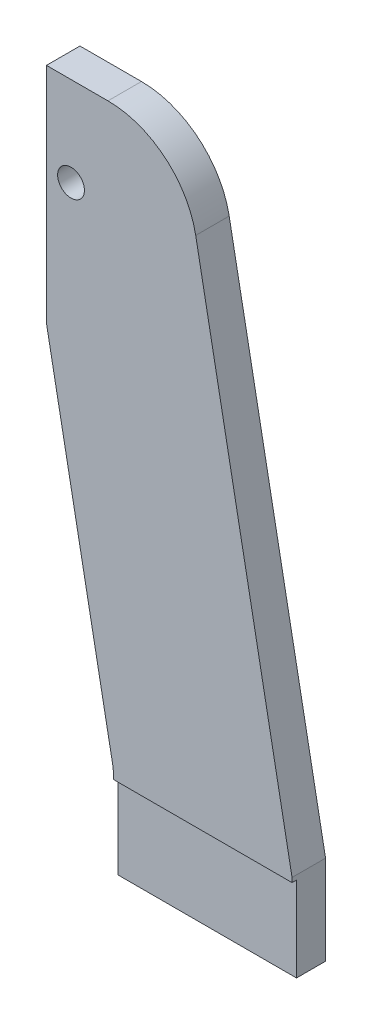
from build123d import *

# Parameters (mm, degrees)
SALIENTE_EXTRUIR1_DEPTH                        = 15
CROQUIS2_R                                     = 6
CORTAR_EXTRUIR1_DEPTH                          = 311.845620847
PERFORADOR_PARA_ROSCAR_PARA_MACHO_DE_ROS_D     = 3.3
PERFORADOR_PARA_ROSCAR_PARA_MACHO_DE_ROS_DEPTH = 7
PERFORADOR_PARA_ROSCAR_PARA_MACHO_DE_ROS_TIP   = 0.991420021
CROQUIS9_W                                     = 80
CROQUIS9_H                                     = 38
CORTAR_EXTRUIR2_DEPTH                          = 2


with BuildPart() as part:
    # Croquis1 → Saliente-Extruir1 (new body)
    with BuildSketch(Plane.XY):
        with BuildLine():
            Line((80, 0), (80, 40))
            Line((80, 40), (36.844749796, 267.45618268))
            ThreePointArc((36.844749796, 267.45618268), (23.058105258, 290.807850519), (-2.454173088, 300))
            Line((-2.454173088, 300), (-30, 300))
            Line((-30, 300), (-30, 200))
            Line((-30, 200), (-0.350538558, 43.72809134))
            ThreePointArc((-0.350538558, 43.72809134), (-0.087827481, 41.872267497), (0, 40))
            Line((0, 40), (0, 0))
            Line((0, 0), (80, 0))
        make_face()
    extrude(amount=SALIENTE_EXTRUIR1_DEPTH)

    # Croquis2 → Cortar-Extruir1 (cut, through all)
    with BuildSketch(Plane(origin=(0, 0, 0), x_dir=(-1, 0, 0), z_dir=(0, 0, -1))):
        with Locations((19, 260)):
            Circle(CROQUIS2_R)
    extrude(amount=-CORTAR_EXTRUIR1_DEPTH, mode=Mode.SUBTRACT)

    # Perforador para roscar para macho de roscar para M44
    with Locations(Plane(origin=(0, 0, 0), x_dir=(-1, 0, 0), z_dir=(0, 0, -1))):
        with Locations((19, 241.75), (19, 278.25)):
            Hole(PERFORADOR_PARA_ROSCAR_PARA_MACHO_DE_ROS_D / 2, depth=PERFORADOR_PARA_ROSCAR_PARA_MACHO_DE_ROS_DEPTH)
            with Locations((0, 0, -(PERFORADOR_PARA_ROSCAR_PARA_MACHO_DE_ROS_DEPTH + PERFORADOR_PARA_ROSCAR_PARA_MACHO_DE_ROS_TIP / 2))):  # 118° drill point
                Cone(0, PERFORADOR_PARA_ROSCAR_PARA_MACHO_DE_ROS_D / 2, PERFORADOR_PARA_ROSCAR_PARA_MACHO_DE_ROS_TIP, mode=Mode.SUBTRACT)

    # Croquis9 → Cortar-Extruir2 (cut)
    with BuildSketch(Plane.XY.offset(15)):
        with Locations((40, 19)):
            Rectangle(CROQUIS9_W, CROQUIS9_H)
    extrude(amount=-CORTAR_EXTRUIR2_DEPTH, mode=Mode.SUBTRACT)


solid = part.part
